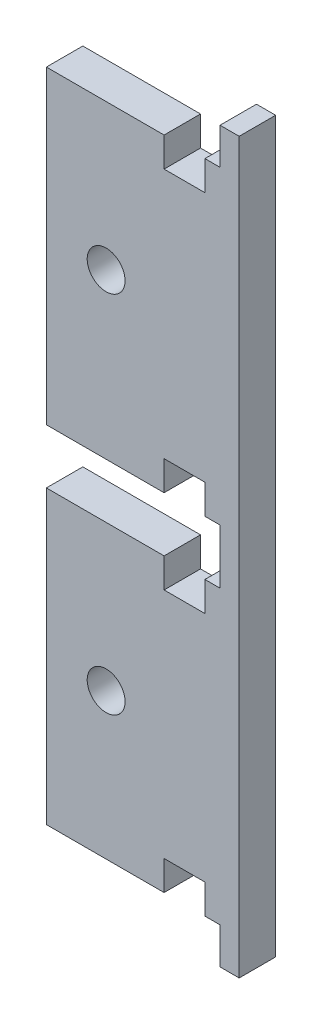
from build123d import *

# Parameters (mm, degrees)
SKETCH2_W               = 40.64
SKETCH2_H               = 127
BOSS_EXTRUDE1_DEPTH     = 6.35
M6_CLEARANCE_HOLE1_D    = 6.6
CUT_EXTRUDE1_DEPTH      = 134.495063954
CUT_EXTRUDE1_DEPTH_BACK = 134.495063954
SKETCH5_W               = 7.0505
SKETCH5_H               = 127
SKETCH6_W               = 30.25575
SKETCH6_H               = 6.35
SKETCH6_H_2             = 9.525
CUT_EXTRUDE2_DEPTH      = 134.495063954
SKETCH7_W               = 7.112
SKETCH7_H               = 5.5245
CUT_EXTRUDE3_DEPTH      = 134.495063954


with BuildPart() as part:
    # Sketch2 → Boss-Extrude1 (new body)
    with BuildSketch(Plane.XY):
        with Locations((20.32, 63.5)):
            Rectangle(SKETCH2_W, SKETCH2_H)
    extrude(amount=BOSS_EXTRUDE1_DEPTH)

    # M6 Clearance Hole1 (through all)
    with Locations(Plane.XY.offset(6.35)):
        with Locations((17.4625, 31.75), (17.4625, 95.25)):
            Hole(M6_CLEARANCE_HOLE1_D / 2)

    # Sketch5 → Cut-Extrude1 (cut, two sides: drawn at the far end of the back side and taken through both)
    with BuildSketch(Plane.XY.offset(6.35).offset(-CUT_EXTRUDE1_DEPTH_BACK)):
        with Locations((3.52525, 63.5)):
            Rectangle(SKETCH5_W, SKETCH5_H)
    extrude(amount=CUT_EXTRUDE1_DEPTH + CUT_EXTRUDE1_DEPTH_BACK, mode=Mode.SUBTRACT)

    # Sketch6 → Cut-Extrude2 (cut, through all)
    with BuildSketch(Plane.XY.offset(6.35)):
        with Locations((22.178375, 123.825)):
            Rectangle(SKETCH6_W, SKETCH6_H)
        with Locations((22.178375, 61.9125)):
            Rectangle(SKETCH6_W, SKETCH6_H_2)
        with Locations((22.178375, 3.175)):
            Rectangle(SKETCH6_W, SKETCH6_H)
    extrude(amount=-CUT_EXTRUDE2_DEPTH, mode=Mode.SUBTRACT)

    # Sketch7 → Cut-Extrude3 (cut, through all)
    with BuildSketch(Plane.XY.offset(6.35)):
        with Locations((31.115, 118.26875)):
            Rectangle(SKETCH7_W, SKETCH7_H)
        with Locations((31.115, 69.05625)):
            Rectangle(SKETCH7_W, SKETCH7_H)
        with Locations((31.115, 54.76875)):
            Rectangle(SKETCH7_W, SKETCH7_H)
        with Locations((31.115, 8.73125)):
            Rectangle(SKETCH7_W, SKETCH7_H)
    extrude(amount=-CUT_EXTRUDE3_DEPTH, mode=Mode.SUBTRACT)


solid = part.part
